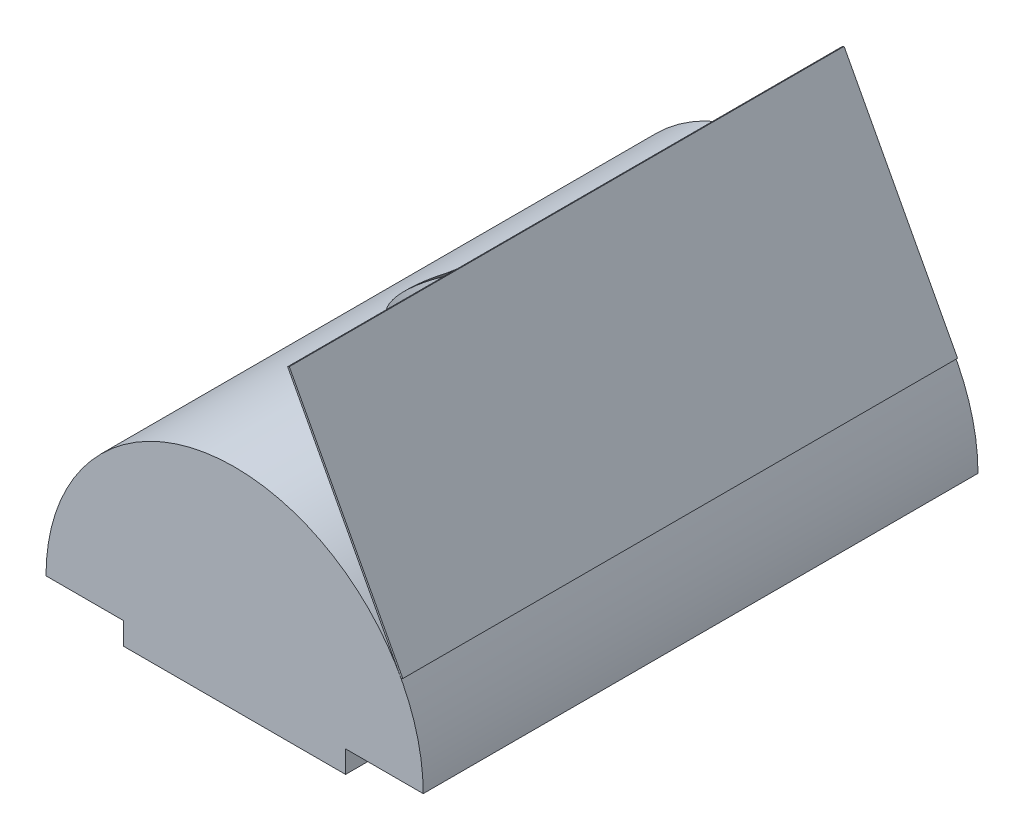
from build123d import *

# Parameters (mm, degrees)
EXTRUDE_1_DEPTH     = 20
SKETCH_2_R          = 3
CUT_EXTRUDE_1_DEPTH = 20
SWEEP_1_PITCH       = 1
EXTRUDE_2_DEPTH     = 20


with BuildPart() as part:
    # 草图1 → 凸台-拉伸1 (new body)
    with BuildSketch(Plane.XY):
        with BuildLine():
            Line((-6.8, 0), (-4, 0))
            Line((-4, 0), (-4, -0.8))
            Line((-4, -0.8), (4, -0.8))
            Line((4, -0.8), (4, 0))
            Line((4, 0), (6.8, 0))
            ThreePointArc((6.8, 0), (0, 6.8), (-6.8, 0))
        make_face()
    extrude(amount=EXTRUDE_1_DEPTH)

    # 草图2 → 切除-拉伸1 (cut)
    with BuildSketch(Plane.XZ.offset(0.8)):
        with Locations(Location((0, 10.397214241, 0), (0, 0, 270))):
            Circle(SKETCH_2_R)
    extrude(amount=-CUT_EXTRUDE_1_DEPTH, mode=Mode.SUBTRACT)

    # 切除-扫描1: arcs per turn and ends read off the stored shape
    # 切除-扫描1: the profile of 草图4 profile screwed along a right-hand helix through 8 turns, 8 arcs to a turn; built about Z, then put on its axis
    sweep_1_z = Axis((0, 0, 0), (0, 0, 1))
    sweep_1_corners = [(2.9997, 0, 0.400300007), (2.9997, 0, -0.400299993), (3.4, 0, 7e-09)]
    with BuildLine(mode=Mode.PRIVATE) as sweep_1_profile:
        Line(sweep_1_corners[0], sweep_1_corners[1])
        Line(sweep_1_corners[1], sweep_1_corners[2])
        Line(sweep_1_corners[2], sweep_1_corners[0])
    sweep_1_cap = Face(sweep_1_profile.wire())
    sweep_1_turn_angles = [0, 22.5, 45, 67.5, 90, 112.5, 135, 157.5, 180, 202.5, 225, 247.5, 270, 292.5, 315, 337.5, 360]
    sweep_1_turn_weights = [1, 0.9238795325112867, 1, 0.9238795325112867, 1, 0.9238795325112867, 1, 0.9238795325112867, 1, 0.9238795325112867, 1, 0.9238795325112867, 1, 0.9238795325112867, 1, 0.9238795325112867, 1]
    sweep_1_turn_rails = [Edge.make_bspline([Vector(p[0], p[1], 0).rotate(sweep_1_z, sweep_1_turn_angles[k]) / sweep_1_turn_weights[k] + Vector(0, 0, p[2] + SWEEP_1_PITCH * sweep_1_turn_angles[k] / 360) for k in range(17)], [0, 0, 0, 1, 1, 2, 2, 3, 3, 4, 4, 5, 5, 6, 6, 7, 7, 8, 8, 8], 2, sweep_1_turn_weights) for p in sweep_1_corners]
    sweep_1_turn_sides = [Face.make_surface_from_curves(sweep_1_turn_rails[p[0]], sweep_1_turn_rails[p[1]]) for p in [(0, 1), (1, 2), (2, 0)]]
    sweep_1 = Plane(origin=(0, -0.8, 10.397214241), x_dir=(0.7071067811865439, 0, 0.7071067811865511), z_dir=(0, 1, 0)) * Solid(Shell([*[p.moved(Location((0, 0, SWEEP_1_PITCH * i))) for i in range(8) for p in sweep_1_turn_sides], sweep_1_cap, sweep_1_cap.rotate(sweep_1_z, 2880).moved(Location((0, 0, SWEEP_1_PITCH * 2880 / 360)))]))
    add(sweep_1, mode=Mode.SUBTRACT)


with BuildPart() as body_2:
    # 草图5 → 凸台-拉伸2 (new body)
    with BuildSketch(Plane.XY.offset(20)):
        Polygon((6.003652369, 3.193142377), (1.911816595, 10.886491635), (1.971160175, 10.918054506), (6.062995949, 3.224705247), align=None)
    extrude(amount=-EXTRUDE_2_DEPTH)


solid = Compound([part.part, body_2.part])
